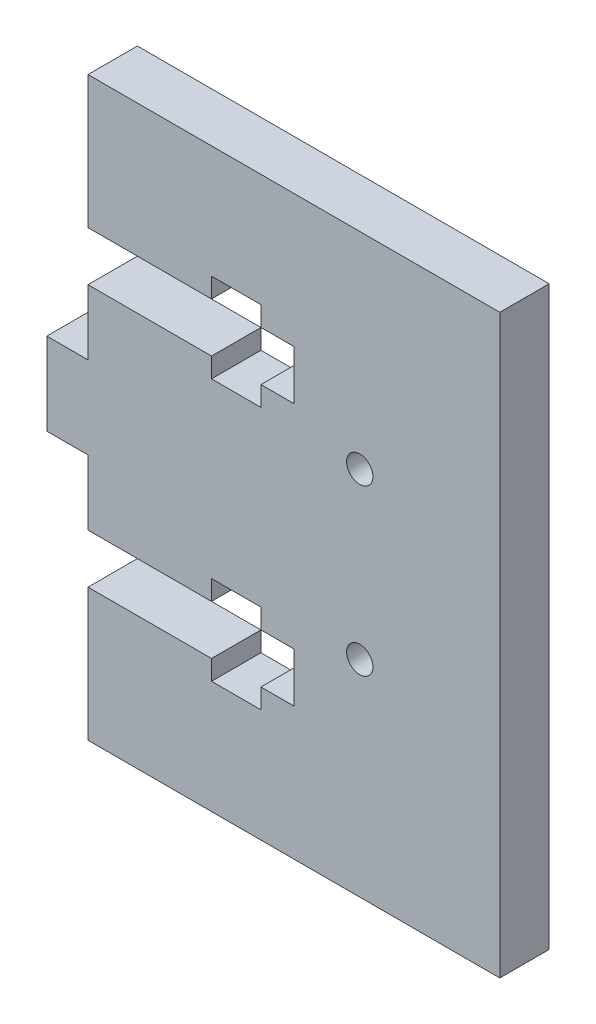
from build123d import *

# Parameters (mm, degrees)
SKETCH1_R           = 1.6
BOSS_EXTRUDE1_DEPTH = 6


with BuildPart() as part:
    # Sketch1 → Boss-Extrude1 (new body)
    with BuildSketch(Plane.XY):
        Polygon((-68, -35), (-118, -35), (-118, -18.9), (-103, -18.9), (-103, -21.3), (-97, -21.3), (-97, -18.9), (-93, -18.9), (-93, -12.9), (-97, -12.9), (-97, -10.5), (-103, -10.5), (-103, -12.9), (-118, -12.9), (-118, -5), (-123, -5), (-123, 5), (-118, 5), (-118, 12.9), (-103, 12.9), (-103, 10.5), (-97, 10.5), (-97, 12.9), (-93, 12.9), (-93, 18.9), (-97, 18.9), (-97, 21.3), (-103, 21.3), (-103, 18.9), (-118, 18.9), (-118, 35), (-68, 35), align=None)
        with Locations((-85, -10)):
            Circle(SKETCH1_R, mode=Mode.SUBTRACT)
        with Locations((-85, 10)):
            Circle(SKETCH1_R, mode=Mode.SUBTRACT)
    extrude(amount=BOSS_EXTRUDE1_DEPTH)


solid = part.part
